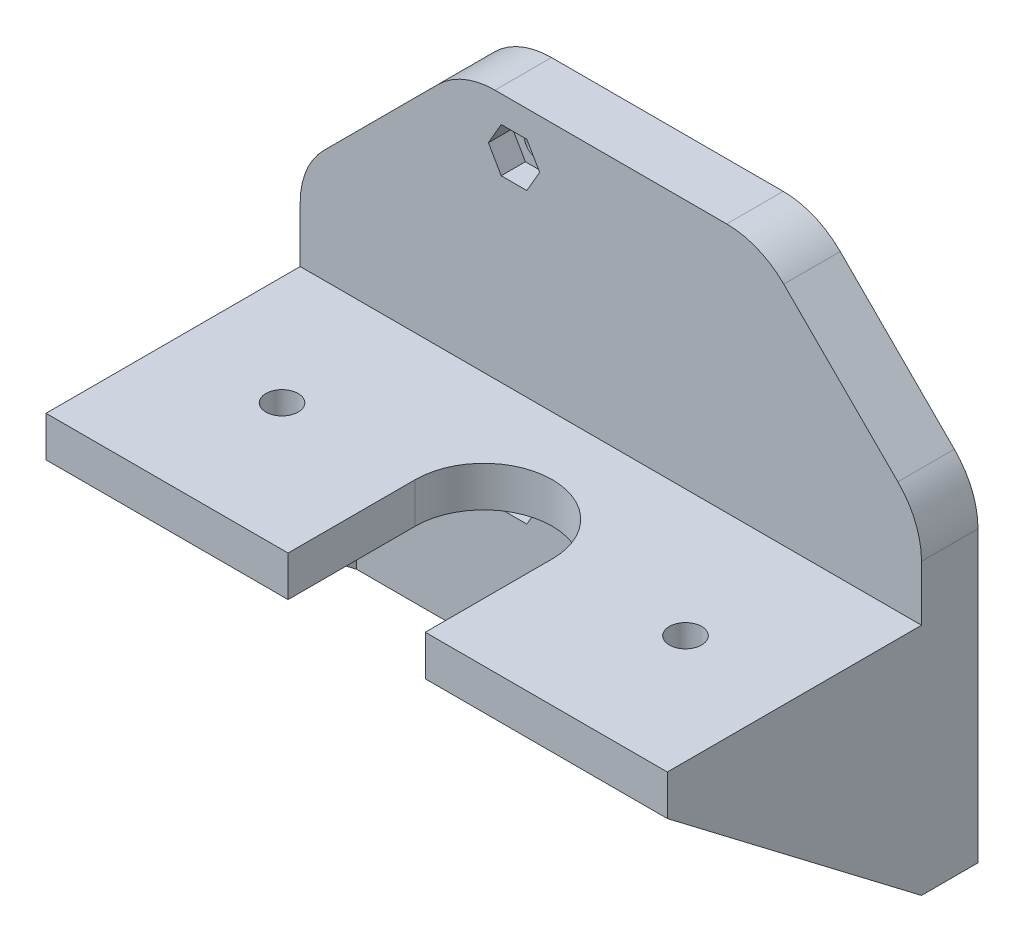
from build123d import *

# Parameters (mm, degrees)
SKETCH1_W           = 77
SKETCH1_H           = 60
SKETCH1_R           = 1.75
BOSS_EXTRUDE1_DEPTH = 7
SKETCH2_W           = 77
SKETCH2_H           = 5
BOSS_EXTRUDE2_DEPTH = 31.5
CUT_EXTRUDE1_DEPTH  = 20
SKETCH4_R           = 2
CUT_EXTRUDE2_DEPTH  = 20
RIB2_REACH          = 97.722
SKETCH5_WALL_W      = 233.044835642
SKETCH5_WALL_H      = 7
CHAMFER1_SIZE       = 20
FILLET1_R           = 10
CUT_EXTRUDE3_DEPTH  = 3


with BuildPart() as part:
    # Sketch1 → Boss-Extrude1 (new body)
    with BuildSketch(Plane.XY):
        with Locations((-12, 11.85)):
            Rectangle(SKETCH1_W, SKETCH1_H)
        with Locations((-24, 35.8)):
            Circle(SKETCH1_R, mode=Mode.SUBTRACT)
        with Locations((-24, 0)):
            Circle(SKETCH1_R, mode=Mode.SUBTRACT)
        Circle(SKETCH1_R, mode=Mode.SUBTRACT)
    extrude(amount=BOSS_EXTRUDE1_DEPTH)

    # Sketch2 → Boss-Extrude2 (add)
    with BuildSketch(Plane.XY.offset(7)):
        with Locations((-12, 8.35)):
            Rectangle(SKETCH2_W, SKETCH2_H)
    extrude(amount=BOSS_EXTRUDE2_DEPTH)

    # Sketch3 → Cut-Extrude1 (cut)
    with BuildSketch(Plane(origin=(0, 10.85, 0), x_dir=(1, 0, 0), z_dir=(0, 1, 0))):
        with BuildLine():
            Line((-20.5, -22.75), (-20.5, -38.5))
            Line((-20.5, -38.5), (-3.5, -38.5))
            Line((-3.5, -38.5), (-3.5, -22.75))
            ThreePointArc((-3.5, -22.75), (-12, -14.25), (-20.5, -22.75))
        make_face()
    extrude(amount=-CUT_EXTRUDE1_DEPTH, mode=Mode.SUBTRACT)

    # Sketch4 → Cut-Extrude2 (cut)
    with BuildSketch(Plane(origin=(0, 10.85, 0), x_dir=(1, 0, 0), z_dir=(0, 1, 0))):
        with Locations((13, -22.75)):
            Circle(SKETCH4_R)
        with Locations((-37, -22.75)):
            Circle(SKETCH4_R)
    extrude(amount=-CUT_EXTRUDE2_DEPTH, mode=Mode.SUBTRACT)

    # Sketch5 wall → Rib2 (add, up to next)
    with BuildSketch(Plane(origin=(26.5, -6.15, 22.75), x_dir=(0, -0.606043215263, -0.795431720032), z_dir=(0, 0.795431720032, -0.606043215263)), mode=Mode.PRIVATE) as rib2_sk1:
        with Locations((0, 3.5)):
            Rectangle(SKETCH5_WALL_W, SKETCH5_WALL_H)
    rib2_tool1 = extrude(rib2_sk1.sketch, amount=RIB2_REACH, mode=Mode.PRIVATE) - part.part
    rib2 = rib2_tool1.solids().sort_by_distance((26.5, -6.15, 22.75))[0]
    add(rib2)

    # Mirror1: Rib2 across plane
    add(rib2.mirror(Plane(origin=(-12, 0, 0), x_dir=(0, 0, 1), z_dir=(1, 0, 0))))

    # Chamfer1
    chamfer1_edges = [part.edges().sort_by_distance(p)[0] for p in [
        (-50.5, 41.85, 3.5),
        (26.5, 41.85, 3.5),
    ]]
    chamfer(chamfer1_edges, length=CHAMFER1_SIZE)

    # Fillet1
    fillet1_edges = [part.edges().sort_by_distance(p)[0] for p in [
        (-50.5, 21.85, 3.5),
        (-30.5, 41.85, 3.5),
        (26.5, 21.85, 3.5),
        (6.5, 41.85, 3.5),
    ]]
    fillet(fillet1_edges, radius=FILLET1_R)

    # Sketch6 → Cut-Extrude3 (cut)
    with BuildSketch(Plane.XY.offset(7)):
        Polygon((-22.41228676, 33.05), (-20.824573519, 35.8), (-22.41228676, 38.55), (-25.58771324, 38.55), (-27.175426481, 35.8), (-25.58771324, 33.05), align=None)
        Polygon((-22.41228676, -2.75), (-20.824573519, 0), (-22.41228676, 2.75), (-25.58771324, 2.75), (-27.175426481, 0), (-25.58771324, -2.75), align=None)
        Polygon((1.58771324, -2.75), (3.175426481, 0), (1.58771324, 2.75), (-1.58771324, 2.75), (-3.175426481, 0), (-1.58771324, -2.75), align=None)
    extrude(amount=-CUT_EXTRUDE3_DEPTH, mode=Mode.SUBTRACT)


solid = part.part
